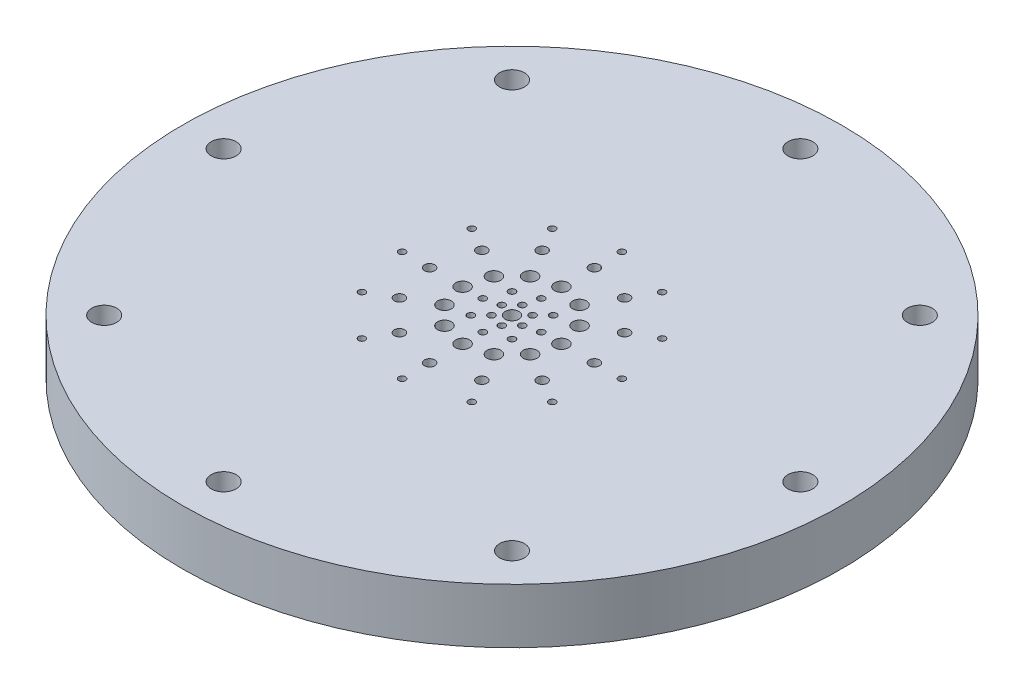
from build123d import *

# Parameters (mm, degrees)
SKETCH1_R                                      = 38.1
BOSS_EXTRUDE1_DEPTH                            = 6.35
CBORE_FOR_4_BUTTON_HEAD_CAP_SCREW1_D           = 2.8702
CBORE_FOR_4_BUTTON_HEAD_CAP_SCREW1_CBORE_D     = 4.826
CBORE_FOR_4_BUTTON_HEAD_CAP_SCREW1_CBORE_DEPTH = 1.905
CIRPATTERN1_COUNT                              = 8
SKETCH7_R                                      = 0.3937
SKETCH7_R_2                                    = 0.5969
SKETCH7_R_3                                    = 0.8001
SKETCH7_R_4                                    = 0.79375
CUT_EXTRUDE1_DEPTH                             = 55.254423783
CIRPATTERN3_COUNT                              = 12
CUT_EXTRUDE3_REACH                             = 56.254
SKETCH8_R                                      = 0.396875
CUT_EXTRUDE4_REACH                             = 56.254
SKETCH9_R                                      = 0.396875


with BuildPart() as part:
    # Sketch1 → Boss-Extrude1 (new body)
    with BuildSketch(Plane(origin=(0, 0, 0), x_dir=(1, 0, 0), z_dir=(0, 1, 0))):
        Circle(SKETCH1_R)
    extrude(amount=BOSS_EXTRUDE1_DEPTH)

    # CBORE for #4 Button Head Cap Screw1 (through all)
    with Locations(Plane(origin=(0, 0, 0), x_dir=(-1, 0, 0), z_dir=(0, -1, 0))):
        with Locations((0, -33.3375)):
            cbore_for_4_button_head_cap_screw1 = CounterBoreHole(CBORE_FOR_4_BUTTON_HEAD_CAP_SCREW1_D / 2, CBORE_FOR_4_BUTTON_HEAD_CAP_SCREW1_CBORE_D / 2, CBORE_FOR_4_BUTTON_HEAD_CAP_SCREW1_CBORE_DEPTH)

    # CirPattern1: CBORE for #4 Button Head Cap Screw1 ×8 about axis
    cirpattern1_axis = Axis((0, 0, 0), (0, 1, 0))
    for i in range(1, CIRPATTERN1_COUNT):
        add(cbore_for_4_button_head_cap_screw1.rotate(cirpattern1_axis, i * 360 / CIRPATTERN1_COUNT), mode=Mode.SUBTRACT)

    # Sketch7 → Cut-Extrude1 (cut, through all)
    with BuildSketch(Plane.XZ):
        with Locations((0, 12.7)):
            Circle(SKETCH7_R)
        with Locations((0, 9.525)):
            Circle(SKETCH7_R_2)
        with Locations((0, 5.715)):
            Circle(SKETCH7_R_3)
        Circle(SKETCH7_R_4)
    cut_extrude1 = extrude(amount=-CUT_EXTRUDE1_DEPTH, mode=Mode.SUBTRACT)

    # CirPattern3: Cut-Extrude1 ×12 about axis
    cirpattern3_axis = Axis((0, 0, 0), (0, 1, 0))
    for i in range(1, CIRPATTERN3_COUNT):
        add(cut_extrude1.rotate(cirpattern3_axis, i * 360 / CIRPATTERN3_COUNT), mode=Mode.SUBTRACT)

    # Sketch8 → Cut-Extrude3 (cut, up to next)
    with BuildSketch(Plane(origin=(0, 6.35, 0), x_dir=(1, 0, 0), z_dir=(0, 1, 0)), mode=Mode.PRIVATE) as cut_extrude3_sk1:
        with Locations((3.368817958, 0)):
            Circle(SKETCH8_R)
    cut_extrude3_tool1 = extrude(cut_extrude3_sk1.sketch, amount=-CUT_EXTRUDE3_REACH, mode=Mode.PRIVATE) & part.part
    # Sketch8 → Cut-Extrude3 (cut, up to next)
    with BuildSketch(Plane(origin=(0, 6.35, 0), x_dir=(1, 0, 0), z_dir=(0, 1, 0)), mode=Mode.PRIVATE) as cut_extrude3_sk2:
        with Locations((2.382114023, -2.382114023)):
            Circle(SKETCH8_R)
    cut_extrude3_tool2 = extrude(cut_extrude3_sk2.sketch, amount=-CUT_EXTRUDE3_REACH, mode=Mode.PRIVATE) & part.part
    # Sketch8 → Cut-Extrude3 (cut, up to next)
    with BuildSketch(Plane(origin=(0, 6.35, 0), x_dir=(1, 0, 0), z_dir=(0, 1, 0)), mode=Mode.PRIVATE) as cut_extrude3_sk3:
        with Locations((0, -3.368817958)):
            Circle(SKETCH8_R)
    cut_extrude3_tool3 = extrude(cut_extrude3_sk3.sketch, amount=-CUT_EXTRUDE3_REACH, mode=Mode.PRIVATE) & part.part
    # Sketch8 → Cut-Extrude3 (cut, up to next)
    with BuildSketch(Plane(origin=(0, 6.35, 0), x_dir=(1, 0, 0), z_dir=(0, 1, 0)), mode=Mode.PRIVATE) as cut_extrude3_sk4:
        with Locations((-2.382114023, -2.382114023)):
            Circle(SKETCH8_R)
    cut_extrude3_tool4 = extrude(cut_extrude3_sk4.sketch, amount=-CUT_EXTRUDE3_REACH, mode=Mode.PRIVATE) & part.part
    # Sketch8 → Cut-Extrude3 (cut, up to next)
    with BuildSketch(Plane(origin=(0, 6.35, 0), x_dir=(1, 0, 0), z_dir=(0, 1, 0)), mode=Mode.PRIVATE) as cut_extrude3_sk5:
        with Locations((-3.368817958, 0)):
            Circle(SKETCH8_R)
    cut_extrude3_tool5 = extrude(cut_extrude3_sk5.sketch, amount=-CUT_EXTRUDE3_REACH, mode=Mode.PRIVATE) & part.part
    # Sketch8 → Cut-Extrude3 (cut, up to next)
    with BuildSketch(Plane(origin=(0, 6.35, 0), x_dir=(1, 0, 0), z_dir=(0, 1, 0)), mode=Mode.PRIVATE) as cut_extrude3_sk6:
        with Locations((-2.382114023, 2.382114023)):
            Circle(SKETCH8_R)
    cut_extrude3_tool6 = extrude(cut_extrude3_sk6.sketch, amount=-CUT_EXTRUDE3_REACH, mode=Mode.PRIVATE) & part.part
    # Sketch8 → Cut-Extrude3 (cut, up to next)
    with BuildSketch(Plane(origin=(0, 6.35, 0), x_dir=(1, 0, 0), z_dir=(0, 1, 0)), mode=Mode.PRIVATE) as cut_extrude3_sk7:
        with Locations((0, 3.368817958)):
            Circle(SKETCH8_R)
    cut_extrude3_tool7 = extrude(cut_extrude3_sk7.sketch, amount=-CUT_EXTRUDE3_REACH, mode=Mode.PRIVATE) & part.part
    # Sketch8 → Cut-Extrude3 (cut, up to next)
    with BuildSketch(Plane(origin=(0, 6.35, 0), x_dir=(1, 0, 0), z_dir=(0, 1, 0)), mode=Mode.PRIVATE) as cut_extrude3_sk8:
        with Locations((2.382114023, 2.382114023)):
            Circle(SKETCH8_R)
    cut_extrude3_tool8 = extrude(cut_extrude3_sk8.sketch, amount=-CUT_EXTRUDE3_REACH, mode=Mode.PRIVATE) & part.part
    add(cut_extrude3_tool1.solids().sort_by_distance((3.368818, 6.35, 0))[0], mode=Mode.SUBTRACT)
    add(cut_extrude3_tool2.solids().sort_by_distance((2.382114, 6.35, 2.382114))[0], mode=Mode.SUBTRACT)
    add(cut_extrude3_tool3.solids().sort_by_distance((0, 6.35, 3.368818))[0], mode=Mode.SUBTRACT)
    add(cut_extrude3_tool4.solids().sort_by_distance((-2.382114, 6.35, 2.382114))[0], mode=Mode.SUBTRACT)
    add(cut_extrude3_tool5.solids().sort_by_distance((-3.368818, 6.35, 0))[0], mode=Mode.SUBTRACT)
    add(cut_extrude3_tool6.solids().sort_by_distance((-2.382114, 6.35, -2.382114))[0], mode=Mode.SUBTRACT)
    add(cut_extrude3_tool7.solids().sort_by_distance((0, 6.35, -3.368818))[0], mode=Mode.SUBTRACT)
    add(cut_extrude3_tool8.solids().sort_by_distance((2.382114, 6.35, -2.382114))[0], mode=Mode.SUBTRACT)

    # Sketch9 → Cut-Extrude4 (cut, up to next)
    with BuildSketch(Plane(origin=(0, 6.35, 0), x_dir=(1, 0, 0), z_dir=(0, 1, 0)), mode=Mode.PRIVATE) as cut_extrude4_sk1:
        with Locations((1.187739958, 1.187739958)):
            Circle(SKETCH9_R)
    cut_extrude4_tool1 = extrude(cut_extrude4_sk1.sketch, amount=-CUT_EXTRUDE4_REACH, mode=Mode.PRIVATE) & part.part
    # Sketch9 → Cut-Extrude4 (cut, up to next)
    with BuildSketch(Plane(origin=(0, 6.35, 0), x_dir=(1, 0, 0), z_dir=(0, 1, 0)), mode=Mode.PRIVATE) as cut_extrude4_sk2:
        with Locations((1.622482956, -0.434742998)):
            Circle(SKETCH9_R)
    cut_extrude4_tool2 = extrude(cut_extrude4_sk2.sketch, amount=-CUT_EXTRUDE4_REACH, mode=Mode.PRIVATE) & part.part
    # Sketch9 → Cut-Extrude4 (cut, up to next)
    with BuildSketch(Plane(origin=(0, 6.35, 0), x_dir=(1, 0, 0), z_dir=(0, 1, 0)), mode=Mode.PRIVATE) as cut_extrude4_sk3:
        with Locations((0.434742998, -1.622482956)):
            Circle(SKETCH9_R)
    cut_extrude4_tool3 = extrude(cut_extrude4_sk3.sketch, amount=-CUT_EXTRUDE4_REACH, mode=Mode.PRIVATE) & part.part
    # Sketch9 → Cut-Extrude4 (cut, up to next)
    with BuildSketch(Plane(origin=(0, 6.35, 0), x_dir=(1, 0, 0), z_dir=(0, 1, 0)), mode=Mode.PRIVATE) as cut_extrude4_sk4:
        with Locations((-1.187739958, -1.187739958)):
            Circle(SKETCH9_R)
    cut_extrude4_tool4 = extrude(cut_extrude4_sk4.sketch, amount=-CUT_EXTRUDE4_REACH, mode=Mode.PRIVATE) & part.part
    # Sketch9 → Cut-Extrude4 (cut, up to next)
    with BuildSketch(Plane(origin=(0, 6.35, 0), x_dir=(1, 0, 0), z_dir=(0, 1, 0)), mode=Mode.PRIVATE) as cut_extrude4_sk5:
        with Locations((-1.622482956, 0.434742998)):
            Circle(SKETCH9_R)
    cut_extrude4_tool5 = extrude(cut_extrude4_sk5.sketch, amount=-CUT_EXTRUDE4_REACH, mode=Mode.PRIVATE) & part.part
    # Sketch9 → Cut-Extrude4 (cut, up to next)
    with BuildSketch(Plane(origin=(0, 6.35, 0), x_dir=(1, 0, 0), z_dir=(0, 1, 0)), mode=Mode.PRIVATE) as cut_extrude4_sk6:
        with Locations((-0.434742998, 1.622482956)):
            Circle(SKETCH9_R)
    cut_extrude4_tool6 = extrude(cut_extrude4_sk6.sketch, amount=-CUT_EXTRUDE4_REACH, mode=Mode.PRIVATE) & part.part
    add(cut_extrude4_tool1.solids().sort_by_distance((1.18774, 6.35, -1.18774))[0], mode=Mode.SUBTRACT)
    add(cut_extrude4_tool2.solids().sort_by_distance((1.622483, 6.35, 0.434743))[0], mode=Mode.SUBTRACT)
    add(cut_extrude4_tool3.solids().sort_by_distance((0.434743, 6.35, 1.622483))[0], mode=Mode.SUBTRACT)
    add(cut_extrude4_tool4.solids().sort_by_distance((-1.18774, 6.35, 1.18774))[0], mode=Mode.SUBTRACT)
    add(cut_extrude4_tool5.solids().sort_by_distance((-1.622483, 6.35, -0.434743))[0], mode=Mode.SUBTRACT)
    add(cut_extrude4_tool6.solids().sort_by_distance((-0.434743, 6.35, -1.622483))[0], mode=Mode.SUBTRACT)


solid = part.part
